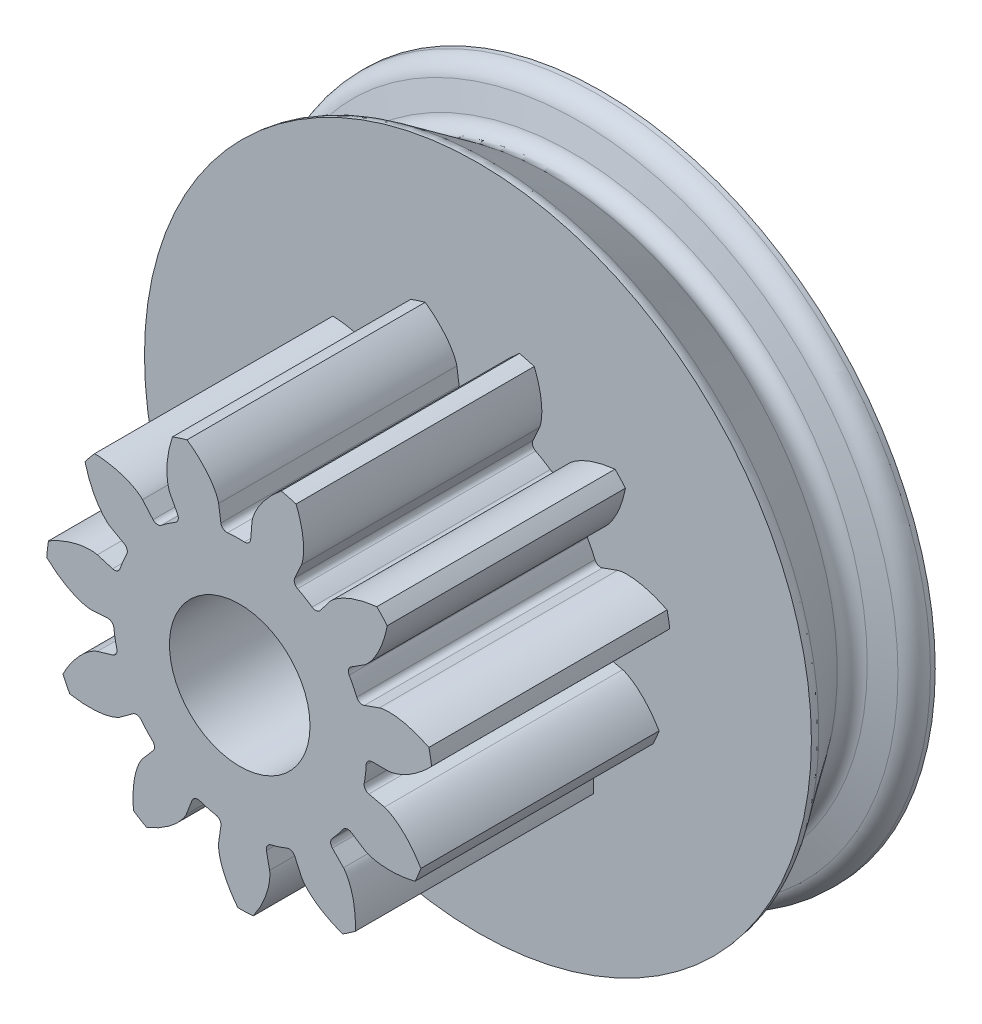
from build123d import *

# Parameters (mm, degrees)
SKETCH2_R                = 8.125
BOSS_EXTRUDE1_DEPTH      = 10
CUT_EXTRUDE1_DEPTH       = 10
FILLET1_R                = 0.254
CIRPATTERN3_COUNT        = 11
FILLET1_OF_CIRPATTERN3_R = 0.254
SKETCH5_R                = 2.95
CUT_EXTRUDE2_DEPTH       = 25.960769331
FILLET2_R                = 1


# Read off the part's stored shape, not the designer's step: Cut-Extrude1
with BuildPart() as part:
    # Sketch2 → Boss-Extrude1 (new body)
    with BuildSketch(Plane.XY):
        Circle(SKETCH2_R)
    extrude(amount=BOSS_EXTRUDE1_DEPTH)

    # Cut-Extrude1 outline → Cut-Extrude1 (cut)
    with BuildSketch(Plane.XY):
        with BuildLine():
            add(Edge.make_bspline(
                [(7.607545512, -2.853222087), (7.585961851, -2.816586512), (7.539496877, -2.739587861), (7.467150286, -2.627069476), (7.362402195, -2.47489246), (7.249903621, -2.326214012), (7.130345817, -2.180659561), (7.007019369, -2.044472173), (6.89348265, -1.930243975), (6.792538275, -1.837438569), (6.70594293, -1.76345785), (6.632775091, -1.70483954), (6.557676253, -1.648585909), (6.48063417, -1.595104105), (6.401619963, -1.544689589), (6.327243484, -1.501722811), (6.258072281, -1.465782317), (6.198134032, -1.438135242), (6.150959182, -1.418802542), (6.113306658, -1.405476679), (6.089923505, -1.398300886), (6.077399235, -1.395116172), (6.072908509, -1.39408529)],
                knots=[0.279209104, 0.279209104, 0.279209104, 0.279209104, 0.279209104, 0.328394301, 0.383126635, 0.43785898, 0.492591256, 0.547323565, 0.602055884, 0.652783571, 0.680149903, 0.707515961, 0.734882063, 0.762248421, 0.789614741, 0.816980391, 0.844236067, 0.862480777, 0.880559096, 0.894007228, 0.903714168, 0.909090916, 0.909090916, 0.909090916, 0.909090916, 0.909090916], degree=4))
            ThreePointArc((7.607545512, -2.853222087), (8.07334194, -0.914754021), (8.053063977, 1.078788946))
            add(Edge.make_bspline(
                [(6.230866036, 0), (6.235473566, 0), (6.248392879, 0.000301816), (6.272788752, 0.002063982), (6.312468264, 0.006627701), (6.362772665, 0.014915466), (6.427377148, 0.028451165), (6.502836081, 0.04800427), (6.584940383, 0.073240914), (6.673231189, 0.104698853), (6.760286137, 0.139587561), (6.846067267, 0.177612608), (6.93049542, 0.218374425), (7.031447847, 0.271104951), (7.150597351, 0.338972511), (7.28681308, 0.424902383), (7.437483479, 0.530044423), (7.586576545, 0.645159253), (7.729488298, 0.764898307), (7.865628813, 0.88978132), (7.961316066, 0.983260547), (8.023830686, 1.04791121), (8.053063977, 1.078788946)],
                knots=[0, 0, 0, 0, 0, 0.005376748, 0.015083688, 0.02853182, 0.046610139, 0.064854849, 0.092110525, 0.119476175, 0.146842495, 0.174208853, 0.201574955, 0.228941013, 0.256307345, 0.307035032, 0.361767351, 0.41649966, 0.471231936, 0.525964281, 0.580696615, 0.629881812, 0.629881812, 0.629881812, 0.629881812, 0.629881812], degree=4))
            Line((6.230866036, 0), (5.3125, 0))
            ThreePointArc((5.3125, 0), (5.278723576, -0.598108398), (5.1778238, -1.188611352))
            Line((5.1778238, -1.188611352), (6.072908509, -1.39408529))
        make_face()
    cut_extrude1 = extrude(amount=CUT_EXTRUDE1_DEPTH, mode=Mode.SUBTRACT)

    # Fillet1
    fillet1_edges = [part.edges().sort_by_distance(p)[0] for p in [
        (5.1778238, -1.188611352, 5),
        (5.3125, 0, 5),
    ]]
    fillet(fillet1_edges, radius=FILLET1_R)

    # CirPattern3: Cut-Extrude1 ×11 about axis
    cirpattern3_axis = Axis((0, 0, 55), (0, 0, -1))
    for i in range(1, CIRPATTERN3_COUNT):
        add(cut_extrude1.rotate(cirpattern3_axis, i * 360 / CIRPATTERN3_COUNT), mode=Mode.SUBTRACT)

    # Fillet1 of CirPattern3
    fillet1_of_cirpattern3_edges = [part.edges().sort_by_distance(p)[0] for p in [
        (3.713250751, -3.799266391, 5),
        (4.469159393, -2.872154343, 5),
        (1.069746825, -5.203681195, 5),
        (2.206892257, -4.832419975, 5),
        (-1.913394159, -4.955963987, 5),
        (-0.756047578, -5.25842641, 5),
        (-4.289046017, -3.134763231, 5),
        (-3.478947649, -4.014919614, 5),
        (-5.30295607, -0.318297297, 5),
        (-5.097306422, -1.496704208, 5),
        (-4.633215039, 2.599225779, 5),
        (-5.097306422, 1.496704208, 5),
        (-2.492460971, 4.691513035, 5),
        (-3.478947649, 4.014919614, 5),
        (0.439631846, 5.294278052, 5),
        (-0.756047578, 5.25842641, 5),
        (3.232144657, 4.216147195, 5),
        (2.206892257, 4.832419975, 5),
        (4.998474377, 1.799419393, 5),
        (4.469159393, 2.872154343, 5),
    ]]
    fillet(fillet1_of_cirpattern3_edges, radius=FILLET1_OF_CIRPATTERN3_R)

    # Sketch4 → Revolve1 (revolve)
    with BuildSketch(Plane(origin=(0, 0, 0), x_dir=(1, 0, 0), z_dir=(0, 1, 0))):
        with BuildLine():
            Line((0, 0), (-14, 0))
            ThreePointArc((-14, 0), (-13.962973561, 0.24056464), (-13.855321635, 0.458861149))
            Line((-13.855321635, 0.458861149), (-12.054190239, 3.031143363))
            ThreePointArc((-12.054190239, 3.031143363), (-11.981865893, 3.580501311), (-12.390390039, 3.95484472))
            Line((-12.390390039, 3.95484472), (-13.407055236, 4.227259339))
            ThreePointArc((-13.407055236, 4.227259339), (-13.834682672, 4.512990857), (-14, 5))
            Line((-14, 5), (-14, 5.2))
            Line((-14, 5.2), (0, 5.2))
            Line((0, 5.2), (0, 5))
            Line((0, 5), (0, 0))
        make_face()
    revolve(axis=Axis((0, 0, -5), (0, 0, 1)))

    # Sketch5 → Cut-Extrude2 (cut, through all)
    with BuildSketch(Plane.XY.offset(10)):
        Circle(SKETCH5_R)
    extrude(amount=-CUT_EXTRUDE2_DEPTH, mode=Mode.SUBTRACT)

    # Fillet2
    fillet2_edges = [part.edges().sort_by_distance(p)[0] for p in [
        (-2.95, 0, -5.2),
    ]]
    fillet(fillet2_edges, radius=FILLET2_R)


solid = part.part
